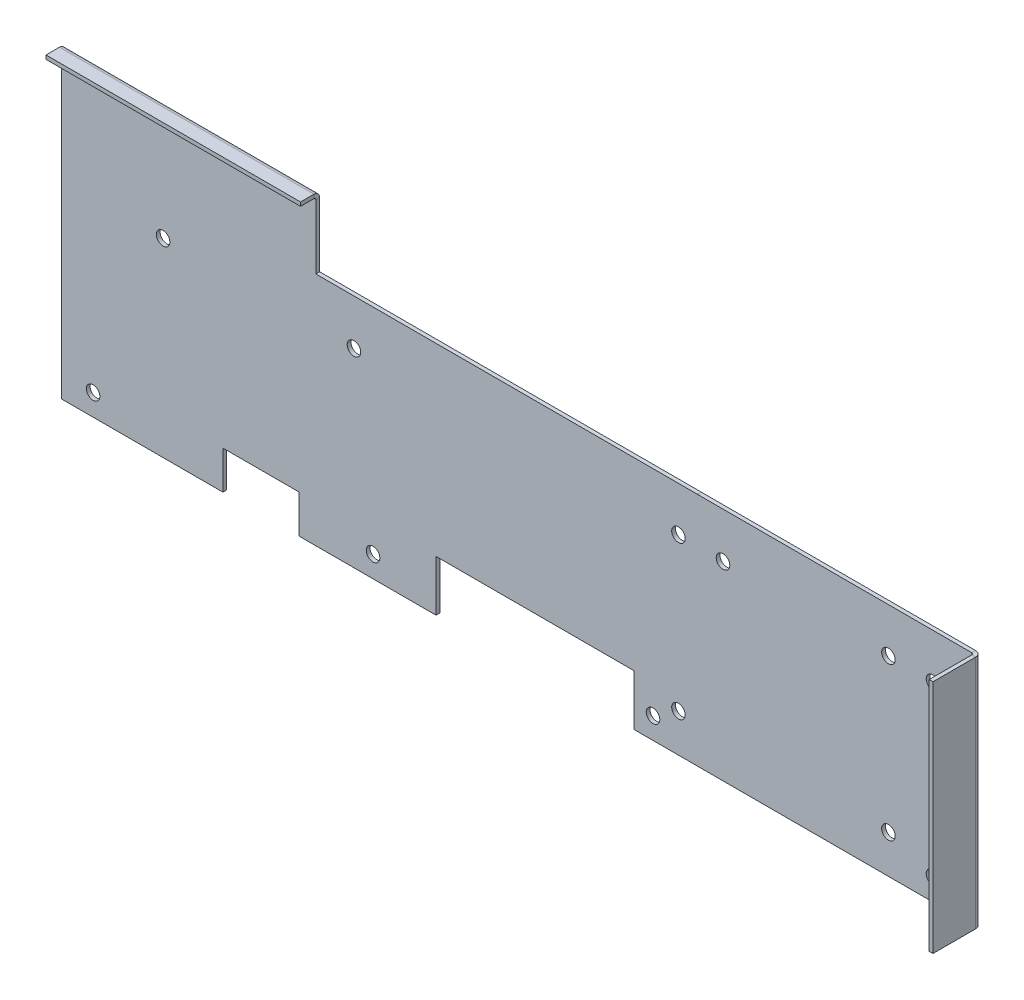
from build123d import *

# Parameters (mm, degrees)
BASE_FLANGE1_DEPTH    = 1.524
MITER_START           = -3.608291964
MITER_FLANGE1_DEPTH   = 93.967487941
MITER_FLANGE1_2_DEPTH = 93.967487941
MITER_FLANGE2_DEPTH   = 101.6
MITER_FLANGE2_2_DEPTH = 101.6
SKETCH6_R             = 2.7051
PCB_MOUNT_HOLES_DEPTH = 2.54
SKETCH7_W             = 78.994
SKETCH7_H             = 20.32
SKETCH7_W_2           = 30.48
SKETCH7_H_2           = 15.24
CUT_EXTRUDE2_DEPTH    = 2.54
SKETCH8_R             = 2.7051
CUT_EXTRUDE3_DEPTH    = 2.54
LPATTERN1_COUNT       = 2
LPATTERN1_PITCH       = 83.82
LPATTERN1_COUNT_DIR2  = 2
LPATTERN1_PITCH_DIR2  = 60.96


# Read off the part's stored shape, not the designer's step: Miter Flange1, Miter Flange2
# Sheet-metal steps are written as plain solids
with BuildPart() as part:
    # Sketch1 → Base-Flange1 (new body)
    with BuildSketch(Plane.XY):
        Polygon((0, 0), (0, -3.608291964), (365.76, -3.608291964), (365.76, 90.359195977), (254, 90.359195977), (254, 90.371708036), (101.6, 90.371708036), (101.6, 118.311708036), (0, 118.311708036), align=None)
    extrude(amount=BASE_FLANGE1_DEPTH)

    # Miter Flange1 outline → Miter Flange1 (cut)
    with BuildSketch(Plane(origin=(0, 0, 0), x_dir=(1, 0, 0), z_dir=(0, 1, 0)).offset(MITER_START)):
        with BuildLine():
            ThreePointArc((363.4994, 0), (364.811869886, -0.420019885), (365.636625492, -1.524))
            Line((365.636625492, -1.524), (365.76, -1.524))
            Line((365.76, -1.524), (365.76, 0))
            Line((365.76, 0), (363.4994, 0))
        make_face()
    extrude(amount=MITER_FLANGE1_DEPTH, mode=Mode.SUBTRACT)

    # Miter Flange1 2 outline → Miter Flange1 2 (add)
    with BuildSketch(Plane(origin=(0, 0, 0), x_dir=(1, 0, 0), z_dir=(0, 1, 0)).offset(MITER_START)):
        with BuildLine():
            Line((364.236, -19.304), (365.76, -19.304))
            Line((365.76, -19.304), (365.76, -2.2606))
            ThreePointArc((365.76, -2.2606), (365.728943037, -1.887169675), (365.636625492, -1.524))
            Line((365.636625492, -1.524), (363.4994, -1.524))
            ThreePointArc((363.4994, -1.524), (364.020254855, -1.739745145), (364.236, -2.2606))
            Line((364.236, -2.2606), (364.236, -19.304))
        make_face()
    extrude(amount=MITER_FLANGE1_2_DEPTH)

    # Miter Flange2 outline → Miter Flange2 (cut)
    with BuildSketch(Plane.YZ):
        with BuildLine():
            Line((118.311708036, 1.524), (118.188333528, 1.524))
            ThreePointArc((118.188333528, 1.524), (117.363577922, 0.420019885), (116.051108036, 0))
            Line((116.051108036, 0), (118.311708036, 0))
            Line((118.311708036, 0), (118.311708036, 1.524))
        make_face()
    extrude(amount=MITER_FLANGE2_DEPTH, mode=Mode.SUBTRACT)

    # Miter Flange2 2 outline → Miter Flange2 2 (add)
    with BuildSketch(Plane.YZ):
        with BuildLine():
            Line((118.311708036, 7.62), (116.787708036, 7.62))
            Line((116.787708036, 7.62), (116.787708036, 2.2606))
            ThreePointArc((116.787708036, 2.2606), (116.571962891, 1.739745145), (116.051108036, 1.524))
            Line((116.051108036, 1.524), (118.188333528, 1.524))
            ThreePointArc((118.188333528, 1.524), (118.280651073, 1.887169675), (118.311708036, 2.2606))
            Line((118.311708036, 2.2606), (118.311708036, 7.62))
        make_face()
    extrude(amount=MITER_FLANGE2_2_DEPTH)

    # Sketch6 → PCB mount holes (cut)
    with BuildSketch(Plane.XY.offset(1.524)):
        with Locations((347.98, 4.926108036)):
            Circle(SKETCH6_R)
        with Locations((347.98, 72.236108036)):
            Circle(SKETCH6_R)
        with Locations((264.16, 72.236108036)):
            Circle(SKETCH6_R)
        with Locations((236.22, 4.926108036)):
            Circle(SKETCH6_R)
        with Locations((12.7, 4.926108036)):
            Circle(SKETCH6_R)
        with Locations((40.64, 72.236108036)):
            Circle(SKETCH6_R)
        with Locations((116.84, 72.236108036)):
            Circle(SKETCH6_R)
        with Locations((124.46, 4.926108036)):
            Circle(SKETCH6_R)
    extrude(amount=-PCB_MOUNT_HOLES_DEPTH, mode=Mode.SUBTRACT)

    # Sketch7 → Cut-Extrude2 (cut)
    with BuildSketch(Plane.XY.offset(1.524)):
        with Locations((189.103, 6.551708036)):
            Rectangle(SKETCH7_W, SKETCH7_H)
        with Locations((79.756, 4.011708036)):
            Rectangle(SKETCH7_W_2, SKETCH7_H_2)
    extrude(amount=-CUT_EXTRUDE2_DEPTH, mode=Mode.SUBTRACT)

    # Sketch8 → Cut-Extrude3 (cut)
    with BuildSketch(Plane.XY.offset(1.524)):
        with Locations((330.2, 11.631708036)):
            Circle(SKETCH8_R)
    cut_extrude3 = extrude(amount=-CUT_EXTRUDE3_DEPTH, mode=Mode.SUBTRACT)

    # LPattern1: Cut-Extrude3 2 × 2
    with Locations(*[(-i * LPATTERN1_PITCH, j * LPATTERN1_PITCH_DIR2, 0) for i in range(LPATTERN1_COUNT) for j in range(LPATTERN1_COUNT_DIR2) if (i, j) != (0, 0)]):
        add(cut_extrude3, mode=Mode.SUBTRACT)


solid = part.part
